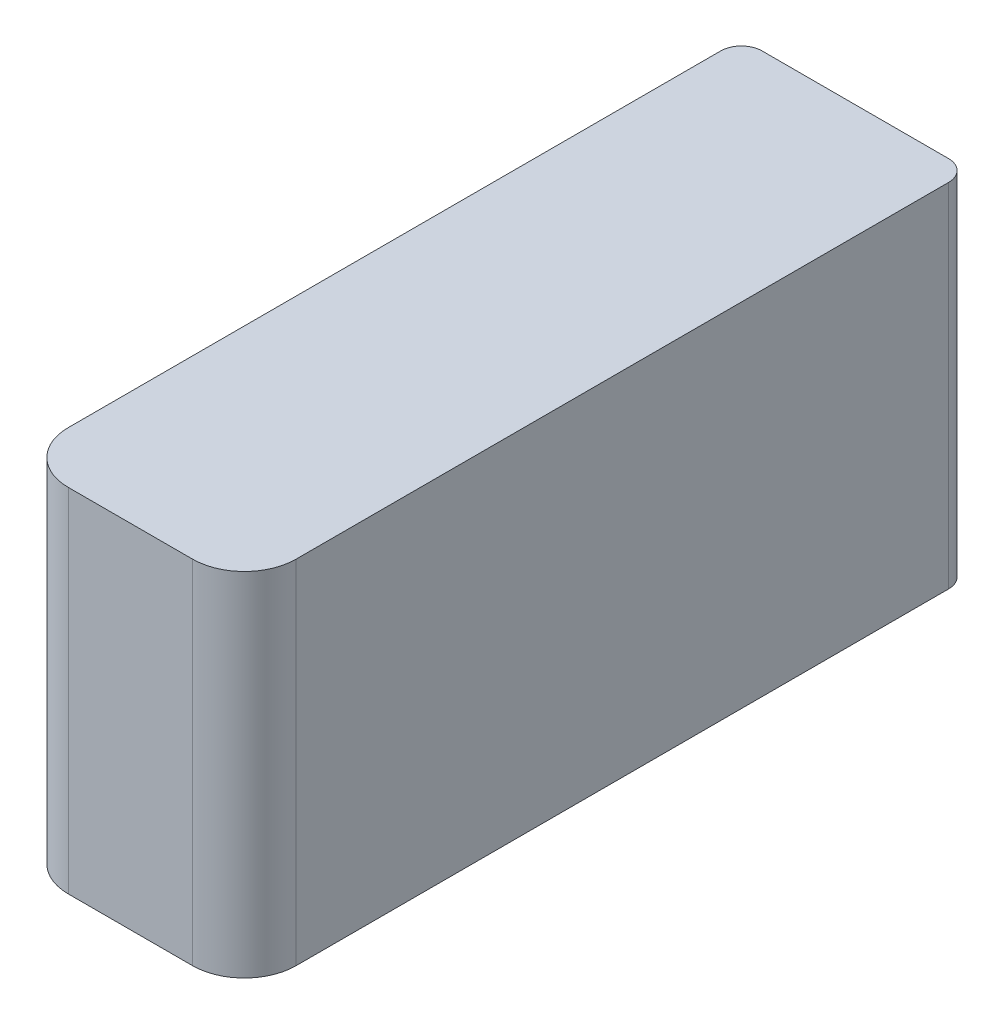
from build123d import *

# Parameters (mm, degrees)
SKETCH1_W           = 22
SKETCH1_H           = 34
BOSS_EXTRUDE1_DEPTH = 35
FILLET1_R           = 2
FILLET2_R           = 5


with BuildPart() as part:
    # Sketch1 → Boss-Extrude1 (new, symmetric)
    with BuildSketch(Plane.XY):
        Rectangle(SKETCH1_W, SKETCH1_H)
    extrude(amount=BOSS_EXTRUDE1_DEPTH, both=True)

    # Fillet1
    fillet1_edges = [part.edges().sort_by_distance(p)[0] for p in [
        (-11, 0, -35),
        (11, 0, -35),
    ]]
    fillet(fillet1_edges, radius=FILLET1_R)

    # Fillet2
    fillet2_edges = [part.edges().sort_by_distance(p)[0] for p in [
        (-11, 0, 35),
        (11, 0, 35),
    ]]
    fillet(fillet2_edges, radius=FILLET2_R)


solid = part.part
